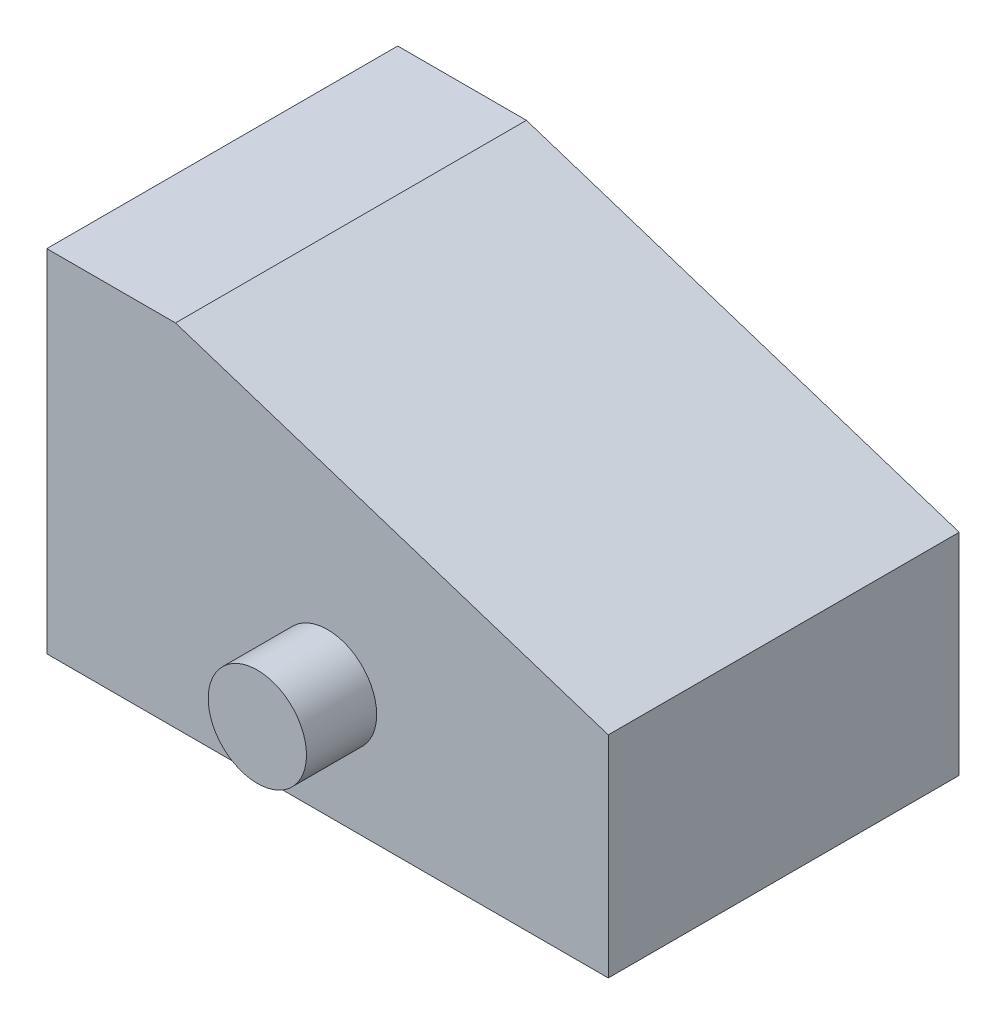
from build123d import *

# Parameters (mm, degrees)
SKETCH_1_W      = 40
SKETCH_1_H      = 25
EXTRUDE_1_DEPTH = 15
SKETCH_2_W      = 9.169537909
SKETCH_2_H      = 25
EXTRUDE_2_DEPTH = 10
OTHER_1_DEPTH   = 25
SKETCH_6_R      = 3.5
EXTRUDE_3_DEPTH = 5
EXTRUDE_START   = 5
SKETCH_7_R      = 3.5
EXTRUDE_4_DEPTH = 5


# Read off the part's stored shape, not the designer's step: 边界1
with BuildPart() as part:
    # 草图1 → 凸台-拉伸1 (new body)
    with BuildSketch(Plane(origin=(0, 0, 0), x_dir=(1, 0, 0), z_dir=(0, 1, 0))):
        with Locations((20, -12.5)):
            Rectangle(SKETCH_1_W, SKETCH_1_H)
    extrude(amount=EXTRUDE_1_DEPTH)

    # 草图2 → 凸台-拉伸2 (add)
    with BuildSketch(Plane(origin=(0, 15, 0), x_dir=(1, 0, 0), z_dir=(0, 1, 0))):
        with Locations((4.584768955, -12.5)):
            Rectangle(SKETCH_2_W, SKETCH_2_H)
    extrude(amount=EXTRUDE_2_DEPTH)

    # 边界1 outline → 边界1 (add)
    with BuildSketch(Plane.XY):
        Polygon((9.169537909, 15), (40, 15), (9.169537909, 25), align=None)
    extrude(amount=OTHER_1_DEPTH)

    # 草图6 → 凸台-拉伸3 (add)
    with BuildSketch(Plane(origin=(0, 0, 0), x_dir=(-1, 0, 0), z_dir=(0, 0, -1))):
        with Locations(Location((-20, 8, 0), (0, 0, 180))):
            Circle(SKETCH_6_R)
    extrude(amount=EXTRUDE_3_DEPTH)

    # 草图7 → 凸台-拉伸4 (add)
    with BuildSketch(Plane.XY.offset(25).offset(EXTRUDE_START)):
        with Locations((20, 8)):
            Circle(SKETCH_7_R)
    extrude(amount=-EXTRUDE_4_DEPTH)


solid = part.part
